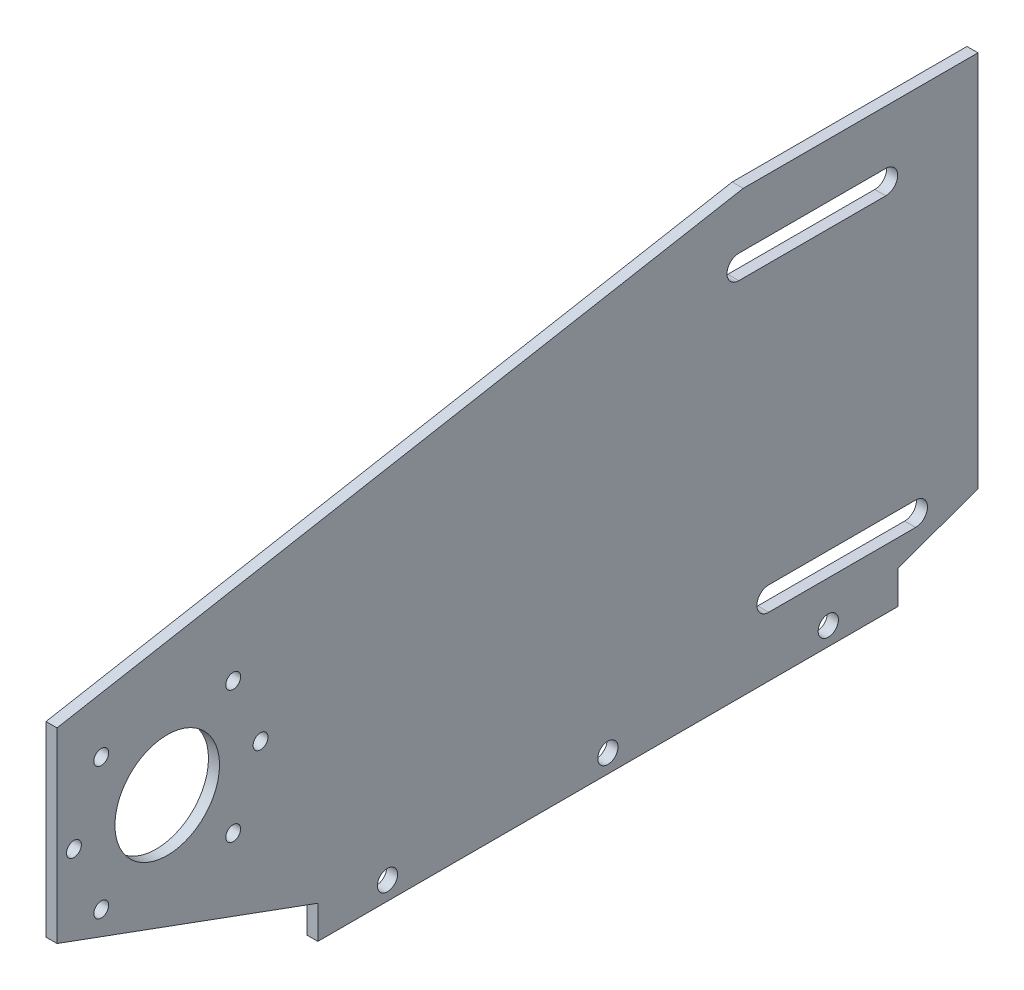
from build123d import *

# Parameters (mm, degrees)
SKETCH1_W           = 300
SKETCH1_H           = 150
SKETCH1_R           = 14.235
BOSS_EXTRUDE1_DEPTH = 3
CUT_EXTRUDE1_REACH  = 337.424
SKETCH2_R           = 3.225
SKETCH4_R           = 2.0193
CUT_EXTRUDE4_DEPTH  = 336.423612765
CUT_EXTRUDE5_DEPTH  = 336.423612765
CUT_EXTRUDE6_DEPTH  = 10
SKETCH7_R           = 2.75
CUT_EXTRUDE7_DEPTH  = 278.817527592


with BuildPart() as part:
    # Sketch1 → Boss-Extrude1 (new body)
    with BuildSketch(Plane(origin=(0, 0, 0), x_dir=(0, 0, -1), z_dir=(1, 0, 0))):
        with Locations((150, 75)):
            Rectangle(SKETCH1_W, SKETCH1_H)
        with Locations((30, 55)):
            Circle(SKETCH1_R, mode=Mode.SUBTRACT)
    extrude(amount=BOSS_EXTRUDE1_DEPTH)

    # Sketch2 → Cut-Extrude1 (cut, up to next)
    with BuildSketch(Plane.ZY, mode=Mode.PRIVATE) as cut_extrude1_sk1:
        with Locations((-10, 110)):
            Circle(SKETCH2_R)
    cut_extrude1_tool1 = extrude(cut_extrude1_sk1.sketch, amount=-CUT_EXTRUDE1_REACH, mode=Mode.PRIVATE) & part.part
    # Sketch2 → Cut-Extrude1 (cut, up to next)
    with BuildSketch(Plane.ZY, mode=Mode.PRIVATE) as cut_extrude1_sk2:
        with BuildLine():
            Line((-225.611446384, 104.938413591), (-185.611446384, 104.938413591))
            ThreePointArc((-185.611446384, 104.938413591), (-182.381446384, 101.708413591), (-185.611446384, 98.478413591))
            Line((-185.611446384, 98.478413591), (-225.611446384, 98.478413591))
            ThreePointArc((-225.611446384, 98.478413591), (-228.841446384, 101.708413591), (-225.611446384, 104.938413591))
        make_face()
    cut_extrude1_tool2 = extrude(cut_extrude1_sk2.sketch, amount=-CUT_EXTRUDE1_REACH, mode=Mode.PRIVATE) & part.part
    # Sketch2 → Cut-Extrude1 (cut, up to next)
    with BuildSketch(Plane.ZY, mode=Mode.PRIVATE) as cut_extrude1_sk3:
        with BuildLine():
            Line((-193.743605698, 16.231694356), (-233.743605698, 16.231694356))
            ThreePointArc((-233.743605698, 16.231694356), (-236.968605698, 19.456694356), (-233.743605698, 22.681694356))
            Line((-233.743605698, 22.681694356), (-193.743605698, 22.681694356))
            ThreePointArc((-193.743605698, 22.681694356), (-190.518605698, 19.456694356), (-193.743605698, 16.231694356))
        make_face()
    cut_extrude1_tool3 = extrude(cut_extrude1_sk3.sketch, amount=-CUT_EXTRUDE1_REACH, mode=Mode.PRIVATE) & part.part
    add(cut_extrude1_tool1.solids().sort_by_distance((0, 110, -10))[0], mode=Mode.SUBTRACT)
    add(cut_extrude1_tool2.solids().sort_by_distance((0, 101.708414, -205.611446))[0], mode=Mode.SUBTRACT)
    add(cut_extrude1_tool3.solids().sort_by_distance((0, 19.456694, -213.743606))[0], mode=Mode.SUBTRACT)

    # Sketch4 → Cut-Extrude4 (cut, through all)
    with BuildSketch(Plane(origin=(3, 0, 0), x_dir=(0, 0, -1), z_dir=(1, 0, 0))):
        with Locations((47.960512242, 37.039487758)):
            Circle(SKETCH4_R)
        with Locations((47.960512242, 72.960512242)):
            Circle(SKETCH4_R)
        with Locations((55.4, 55)):
            Circle(SKETCH4_R)
        with Locations((12.039487758, 72.960512242)):
            Circle(SKETCH4_R)
        with Locations((4.6, 55)):
            Circle(SKETCH4_R)
        with Locations((12.039487758, 37.039487758)):
            Circle(SKETCH4_R)
    extrude(amount=-CUT_EXTRUDE4_DEPTH, mode=Mode.SUBTRACT)

    # Sketch5 → Cut-Extrude5 (cut, through all)
    with BuildSketch(Plane.ZY):
        Polygon((-71, 0), (-71, 9), (0, 35), (0, 0), align=None)
        Polygon((0, 85.848631797), (-186.802640374, 119.641480316), (-300.310491503, 119.641480316), (-300.310491503, 150), (0, 150), align=None)
    extrude(amount=-CUT_EXTRUDE5_DEPTH, mode=Mode.SUBTRACT)

    # Sketch6 → Cut-Extrude6 (cut)
    with BuildSketch(Plane.ZY):
        Polygon((-250.717958721, 16.875947155), (-250.717958721, 165.712896148), (-364.830865455, 165.712896148), (-355.768886916, 0), (-300, 0), (-228.92403237, 0), (-228.92403237, 9), align=None)
    extrude(amount=-CUT_EXTRUDE6_DEPTH, mode=Mode.SUBTRACT)

    # Sketch7 → Cut-Extrude7 (cut, through all)
    with BuildSketch(Plane(origin=(3, 0, 0), x_dir=(0, 0, -1), z_dir=(1, 0, 0))):
        with Locations((89.962016185, 5)):
            Circle(SKETCH7_R)
        with Locations((149.962016185, 5)):
            Circle(SKETCH7_R)
        with Locations((209.962016185, 5)):
            Circle(SKETCH7_R)
    extrude(amount=-CUT_EXTRUDE7_DEPTH, mode=Mode.SUBTRACT)


solid = part.part
